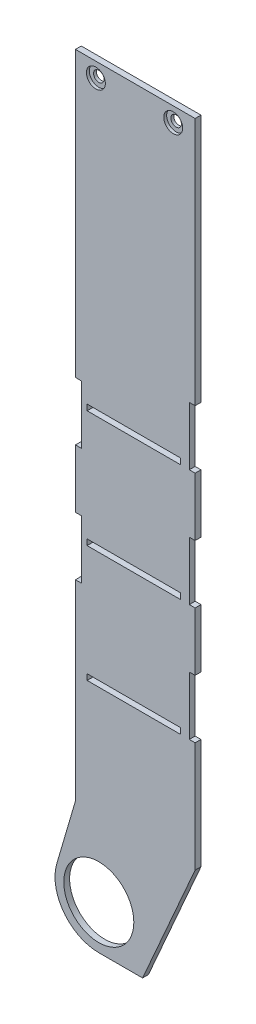
from build123d import *

# Parameters (mm, degrees)
SKETCH_1_R                   = 12
SKETCH_1_W                   = 32
SKETCH_1_H                   = 2
EXTRUDE_1_DEPTH              = 2
HOLE_WIZARD_M3_1_D           = 3.6
HOLE_WIZARD_M3_1_CBORE_D     = 6.5
HOLE_WIZARD_M3_1_CBORE_DEPTH = 1


with BuildPart() as part:
    # 草图1 → 凸台-拉伸1 (new body)
    with BuildSketch(Plane.XY):
        with BuildLine():
            Line((-8, 49), (-8, -48.342527861))
            Line((-8, -48.342527861), (-6, -48.342527861))
            Line((-6, -48.342527861), (-6, -68.342527861))
            Line((-6, -68.342527861), (-8, -68.342527861))
            Line((-8, -68.342527861), (-8, -88.342527861))
            Line((-8, -88.342527861), (-6, -88.342527861))
            Line((-6, -88.342527861), (-6, -108.342527861))
            Line((-6, -108.342527861), (-8, -108.342527861))
            Line((-8, -108.342527861), (-8, -128.342527861))
            Line((-8, -128.342527861), (-8, -174))
            Line((-8, -174), (-14.392579, -195.774639692))
            ThreePointArc((-14.392579, -195.774639692), (-12.007922481, -208.989426995), (0, -215))
            Line((0, -215), (15, -215))
            Line((15, -215), (33, -174))
            Line((33, -174), (33, -136.221540553))
            Line((33, -136.221540553), (31, -136.221540553))
            Line((31, -136.221540553), (31, -116.221540553))
            Line((31, -116.221540553), (33, -116.221540553))
            Line((33, -116.221540553), (33, -96.221540553))
            Line((33, -96.221540553), (31, -96.221540553))
            Line((31, -96.221540553), (31, -76.221540553))
            Line((31, -76.221540553), (33, -76.221540553))
            Line((33, -76.221540553), (33, -56.221540553))
            Line((33, -56.221540553), (31, -56.221540553))
            Line((31, -56.221540553), (31, -36.221540553))
            Line((31, -36.221540553), (33, -36.221540553))
            Line((33, -36.221540553), (33, 49))
            Line((33, 49), (-8, 49))
        make_face()
        with Locations((0, -200)):
            Circle(SKETCH_1_R, mode=Mode.SUBTRACT)
        with Locations((12, -135.221540553)):
            Rectangle(SKETCH_1_W, SKETCH_1_H, mode=Mode.SUBTRACT)
        with Locations((12, -95.221540553)):
            Rectangle(SKETCH_1_W, SKETCH_1_H, mode=Mode.SUBTRACT)
        with Locations((12, -55.221540553)):
            Rectangle(SKETCH_1_W, SKETCH_1_H, mode=Mode.SUBTRACT)
    extrude(amount=EXTRUDE_1_DEPTH)

    # M3 六角凹头盖的柱孔1 (through all)
    with Locations(Plane(origin=(-1, 44, 2), x_dir=(1, 0, 0), z_dir=(0, 0, 1))):
        with Locations((0, 0), (26.5, 0)):
            CounterBoreHole(HOLE_WIZARD_M3_1_D / 2, HOLE_WIZARD_M3_1_CBORE_D / 2, HOLE_WIZARD_M3_1_CBORE_DEPTH)


solid = part.part
